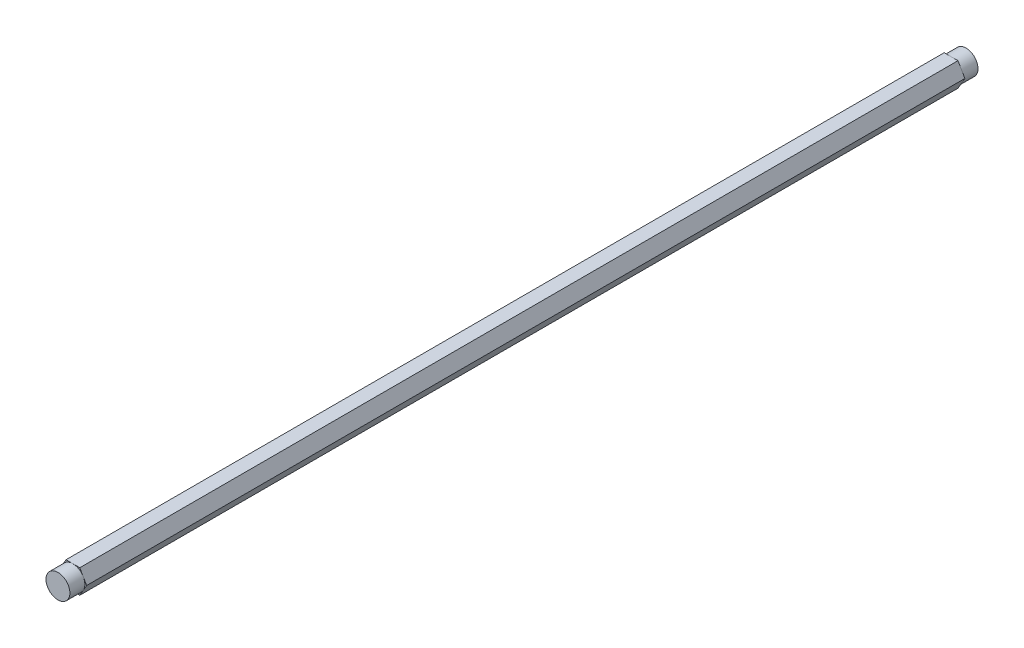
from build123d import *

# Parameters (mm, degrees)
BOSS_EXTRUDE1_DEPTH = 241.3
SKETCH4_OUTSIDE_W   = 113.262
SKETCH4_OUTSIDE_H   = 111.298
SKETCH4_OUTSIDE_R   = 6.35
CUT_EXTRUDE2_DEPTH  = 7.9502


with BuildPart() as part:
    # Sketch1 → Boss-Extrude1 (new, symmetric)
    with BuildSketch(Plane.XY):
        Polygon((3.666174209, -6.35), (7.332348419, 0), (3.666174209, 6.35), (-3.666174209, 6.35), (-7.332348419, 0), (-3.666174209, -6.35), align=None)
    extrude(amount=BOSS_EXTRUDE1_DEPTH, both=True)

    # Sketch4 outside → Cut-Extrude2 (cut)
    with BuildSketch(Plane.XY.offset(241.3)):
        Rectangle(SKETCH4_OUTSIDE_W, SKETCH4_OUTSIDE_H)
        Circle(SKETCH4_OUTSIDE_R, mode=Mode.SUBTRACT)
    cut_extrude2 = extrude(amount=-CUT_EXTRUDE2_DEPTH, mode=Mode.SUBTRACT)

    # Mirror1: Cut-Extrude2 across plane
    add(cut_extrude2.mirror(Plane.XY), mode=Mode.SUBTRACT)


solid = part.part
